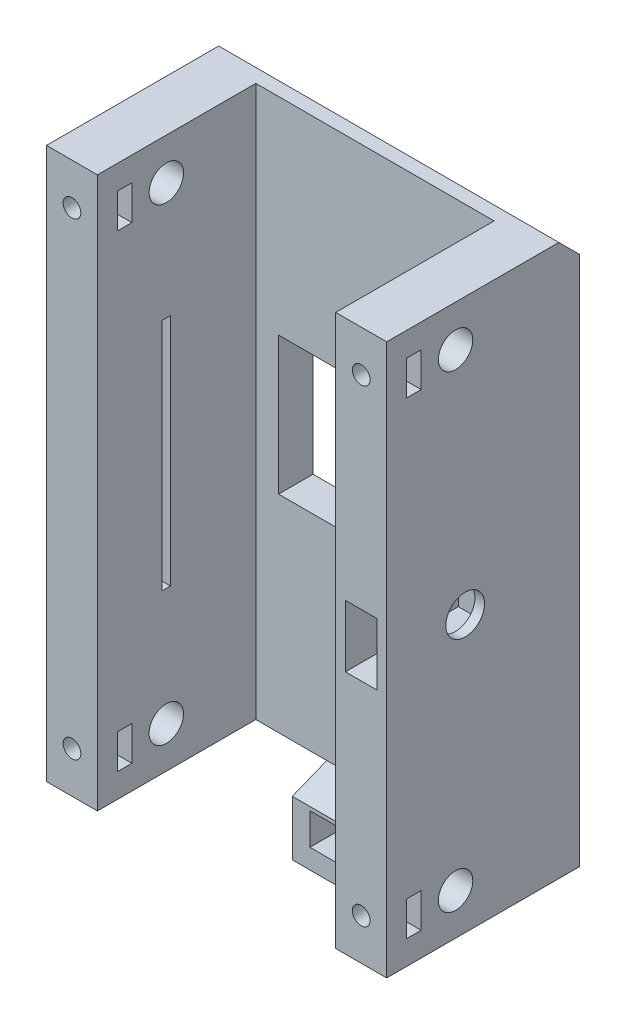
from build123d import *

# Parameters (mm, degrees)
SKETCH1_W                   = 114.3
SKETCH1_H                   = 127
BOSS_EXTRUDE1_DEPTH         = 6.35
SKETCH2_W                   = 9.398
SKETCH2_H                   = 101.6
BOSS_EXTRUDE2_DEPTH         = 29.21
SKETCH10_R                  = 3.175
CUT_EXTRUDE1_DEPTH          = 115.596583549
SKETCH13_W                  = 2.667
SKETCH13_H                  = 6.35
CUT_EXTRUDE2_DEPTH          = 9.398
CUT_EXTRUDE3_REACH          = 92.286
SKETCH15_W                  = 25.4
SKETCH15_H                  = 25.4
MIRROR4_COPY_1_SKETCH_W     = 2.667
MIRROR4_COPY_1_SKETCH_H     = 6.35
MIRROR4_COPY_1_DEPTH        = 9.398
SKETCH19_W                  = 1.524
SKETCH19_H                  = 43.18
CUT_EXTRUDE4_DEPTH          = 5.08
SKETCH23_W                  = 5.842
SKETCH23_H                  = 11.43
CUT_EXTRUDE5_DEPTH          = 20.828
SKETCH24_W                  = 127.881325932
SKETCH24_H                  = 16.190143287
CUT_EXTRUDE6_DEPTH          = 12.7
SKETCH26_W                  = 20.33012471
SKETCH26_H                  = 111.91731712
CUT_EXTRUDE8_DEPTH          = 25.781
CHAMFER1_SIZE               = 3.81
SKETCH28_W                  = 17.78
SKETCH28_H                  = 12.7
BOSS_EXTRUDE3_DEPTH         = 12.7
SKETCH30_W                  = 11.43
SKETCH30_H                  = 5.842
CUT_EXTRUDE9_DEPTH          = 75.423408732
F_1_4_CLEARANCE_HOLE1_D     = 7.14248
F_1_4_CLEARANCE_HOLE1_DEPTH = 3.636839777
CHAMFER3_SIZE2              = 6.35
CHAMFER3_SIZE               = 2.54
F_1_4_CLEARANCE_HOLE2_D     = 7.14248
F_1_4_CLEARANCE_HOLE2_DEPTH = 15.24


with BuildPart() as part:
    # Sketch1 → Boss-Extrude1 (new body)
    with BuildSketch(Plane.XY):
        Rectangle(SKETCH1_W, SKETCH1_H)
    extrude(amount=BOSS_EXTRUDE1_DEPTH)

    # Sketch2 → Boss-Extrude2 (add)
    with BuildSketch(Plane.XY.offset(6.35)):
        with Locations((26.67, 0)):
            Rectangle(SKETCH2_W, SKETCH2_H)
    boss_extrude2 = extrude(amount=BOSS_EXTRUDE2_DEPTH)

    # Mirror1: Boss-Extrude2 across plane
    add(boss_extrude2.mirror(Plane(origin=(0, 0, 0), x_dir=(0, 0, 1), z_dir=(1, 0, 0))))

    # Sketch10 → Cut-Extrude1 (cut, through all)
    with BuildSketch(Plane(origin=(31.369, 0, 0), x_dir=(0, 0, -1), z_dir=(1, 0, 0))):
        with Locations((-22.86, 43.18)):
            Circle(SKETCH10_R)
    cut_extrude1 = extrude(amount=-CUT_EXTRUDE1_DEPTH, mode=Mode.SUBTRACT)

    # Mirror2: Cut-Extrude1 across plane
    add(cut_extrude1.mirror(Plane.ZX), mode=Mode.SUBTRACT)

    # Sketch13 → Cut-Extrude2 (cut)
    with BuildSketch(Plane(origin=(31.369, 0, 0), x_dir=(0, 0, -1), z_dir=(1, 0, 0))):
        with Locations((-30.5435, 43.18)):
            Rectangle(SKETCH13_W, SKETCH13_H)
    cut_extrude2 = extrude(amount=-CUT_EXTRUDE2_DEPTH, mode=Mode.SUBTRACT)

    # Sketch15 → Cut-Extrude3 (cut, up to next)
    with BuildSketch(Plane.XY.offset(6.35), mode=Mode.PRIVATE) as cut_extrude3_sk1:
        with Locations((-5.08, 0)):
            Rectangle(SKETCH15_W, SKETCH15_H)
    cut_extrude3_tool1 = extrude(cut_extrude3_sk1.sketch, amount=-CUT_EXTRUDE3_REACH, mode=Mode.PRIVATE) & part.part
    add(cut_extrude3_tool1.solids().sort_by_distance((-5.08, 0, 6.35))[0], mode=Mode.SUBTRACT)

    # Sketch16 → #4 Clearance Hole1 (revolve, cut)
    with BuildSketch(Plane(origin=(26.67, 43.18, 35.56), x_dir=(0, -1, 0), z_dir=(1, 0, 0))):
        Polygon((0, 0), (0, 12.918574487), (1.63195, 11.938), (1.63195, 0), align=None)
    f_4_clearance_hole1 = revolve(axis=Axis((26.67, 43.18, 41.91), (0, 0, -1)), mode=Mode.SUBTRACT)

    # Mirror3: Cut-Extrude2, #4 Clearance Hole1 across plane
    add(cut_extrude2.mirror(Plane(origin=(0, 0, 0), x_dir=(0, 0, 1), z_dir=(1, 0, 0))), mode=Mode.SUBTRACT)
    add(f_4_clearance_hole1.mirror(Plane(origin=(0, 0, 0), x_dir=(0, 0, 1), z_dir=(1, 0, 0))), mode=Mode.SUBTRACT)

    # Mirror4: Cut-Extrude2, #4 Clearance Hole1 across plane
    add(cut_extrude2.mirror(Plane.ZX), mode=Mode.SUBTRACT)
    add(f_4_clearance_hole1.mirror(Plane.ZX), mode=Mode.SUBTRACT)

    # Mirror4 copy 1 sketch → Mirror4 copy 1 (cut)
    with BuildSketch(Plane(origin=(-31.369, 0, 0), x_dir=(0, 0, -1), z_dir=(-1, 0, 0))):
        with Locations((-30.5435, 43.18)):
            Rectangle(MIRROR4_COPY_1_SKETCH_W, MIRROR4_COPY_1_SKETCH_H)
    extrude(amount=-MIRROR4_COPY_1_DEPTH, mode=Mode.SUBTRACT)

    # Mirror4 copy 2 sketch → Mirror4 copy 2 (revolve, cut)
    with BuildSketch(Plane(origin=(-26.67, -43.18, 35.56), x_dir=(0, 1, 0), z_dir=(-1, 0, 0))):
        Polygon((0, 0), (0, 12.918574487), (1.63195, 11.938), (1.63195, 0), align=None)
    revolve(axis=Axis((-26.67, -43.18, 41.91), (0, 0, -1)), mode=Mode.SUBTRACT)

    # Sketch19 → Cut-Extrude4 (cut)
    with BuildSketch(Plane(origin=(-21.971, 0, 0), x_dir=(0, 0, -1), z_dir=(1, 0, 0))):
        with Locations((-22.86, 0)):
            Rectangle(SKETCH19_W, SKETCH19_H)
    extrude(amount=-CUT_EXTRUDE4_DEPTH, mode=Mode.SUBTRACT)

    # Sketch23 → Cut-Extrude5 (cut)
    with BuildSketch(Plane.XY.offset(35.56)):
        with Locations((26.67, 0)):
            Rectangle(SKETCH23_W, SKETCH23_H)
    extrude(amount=-CUT_EXTRUDE5_DEPTH, mode=Mode.SUBTRACT)

    # Sketch24 → Cut-Extrude6 (cut)
    with BuildSketch(Plane(origin=(0, 63.5, 0), x_dir=(1, 0, 0), z_dir=(0, 1, 0))):
        with Locations((0, -3.427395894)):
            Rectangle(SKETCH24_W, SKETCH24_H)
    cut_extrude6 = extrude(amount=-CUT_EXTRUDE6_DEPTH, mode=Mode.SUBTRACT)

    # Mirror5: Cut-Extrude6 across plane
    add(cut_extrude6.mirror(Plane.ZX), mode=Mode.SUBTRACT)

    # Sketch26 → Cut-Extrude8 (cut)
    with BuildSketch(Plane(origin=(57.15, 0, 0), x_dir=(0, 0, -1), z_dir=(1, 0, 0))):
        with Locations((-3.366450344, 0)):
            Rectangle(SKETCH26_W, SKETCH26_H)
    cut_extrude8 = extrude(amount=-CUT_EXTRUDE8_DEPTH, mode=Mode.SUBTRACT)

    # Mirror6: Cut-Extrude8 across plane
    add(cut_extrude8.mirror(Plane(origin=(0, 0, 0), x_dir=(0, 0, 1), z_dir=(1, 0, 0))), mode=Mode.SUBTRACT)

    # Chamfer1
    chamfer1_edges = [part.edges().sort_by_distance(p)[0] for p in [
        (0, 50.8, 0),
    ]]
    chamfer(chamfer1_edges, length=CHAMFER1_SIZE)

    # Sketch28 → Boss-Extrude3 (add)
    with BuildSketch(Plane.XZ.offset(50.8)):
        with Locations((0, 6.35)):
            Rectangle(SKETCH28_W, SKETCH28_H)
    extrude(amount=BOSS_EXTRUDE3_DEPTH)

    # Sketch30 → Cut-Extrude9 (cut, through all)
    with BuildSketch(Plane.XY.offset(12.7)):
        with Locations((0.067049503, -56.942160223)):
            Rectangle(SKETCH30_W, SKETCH30_H)
    extrude(amount=-CUT_EXTRUDE9_DEPTH, mode=Mode.SUBTRACT)

    # 1/4 Clearance Hole1
    with Locations(Plane(origin=(0, -63.5, 0), x_dir=(-1, 0, 0), z_dir=(0, -1, 0))):
        with Locations((0, -6.35)):
            Hole(F_1_4_CLEARANCE_HOLE1_D / 2, depth=F_1_4_CLEARANCE_HOLE1_DEPTH)

    # Chamfer3
    chamfer3_edges = [part.edges().sort_by_distance(p)[0] for p in [
        (0, -50.8, 12.7),
    ]]
    chamfer3_side = [part.faces().sort_by_distance(p)[0] for p in [
        (0, -50.8508, 12.7),
    ]]
    chamfer(chamfer3_edges, length=CHAMFER3_SIZE - 0.0001, length2=CHAMFER3_SIZE2 - 0.0001, reference=chamfer3_side[0])  # a hair under: the kernel refuses the full size

    # 1/4 Clearance Hole2
    with Locations(Plane(origin=(31.369, 0, 0), x_dir=(0, 0, -1), z_dir=(1, 0, 0))):
        with Locations((-21.082, 0)):
            Hole(F_1_4_CLEARANCE_HOLE2_D / 2, depth=F_1_4_CLEARANCE_HOLE2_DEPTH)


solid = part.part
